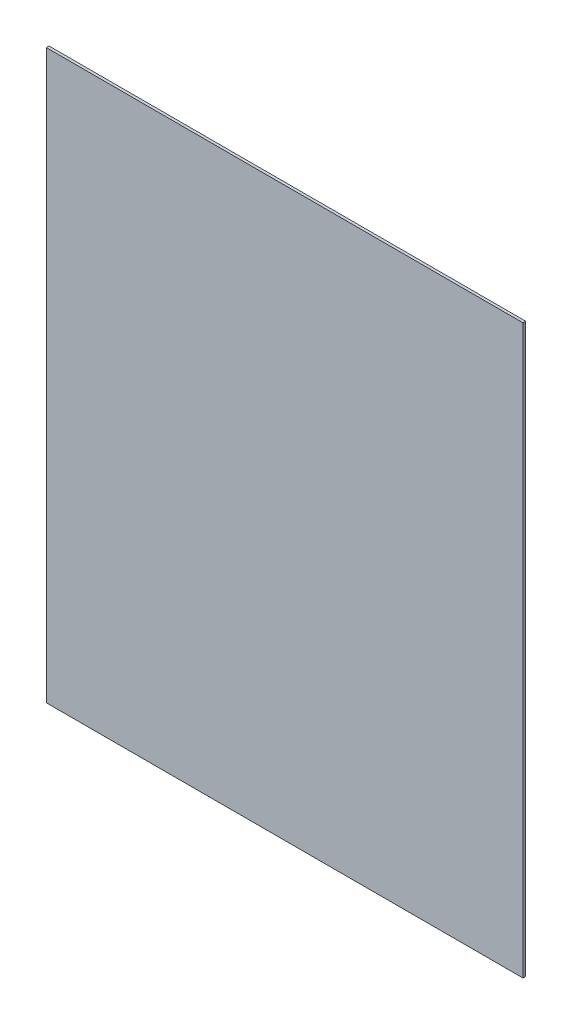
from build123d import *

# Parameters (mm, degrees)
IZIM1_W            = 2100
IZIM1_H            = 2500
TABAN_FLAN_1_DEPTH = 12


# Sheet-metal steps are written as plain solids
with BuildPart() as part:
    # Çizim1 → Taban-Flanş1 (new body)
    with BuildSketch(Plane.XY):
        with Locations((1050, 1250)):
            Rectangle(IZIM1_W, IZIM1_H)
    extrude(amount=-TABAN_FLAN_1_DEPTH)


solid = part.part
